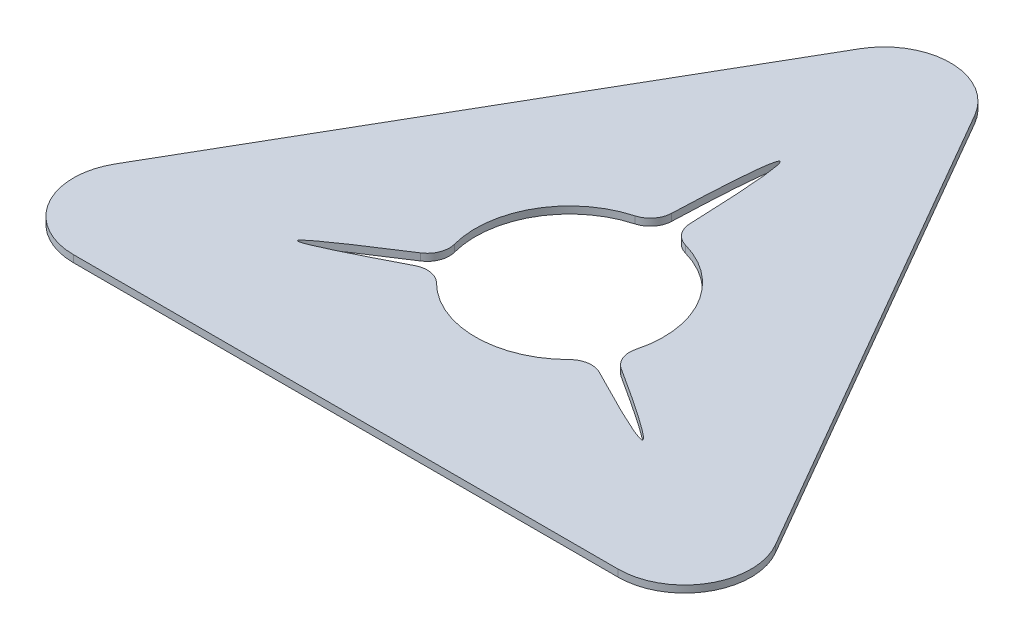
from build123d import *

# Parameters (mm, degrees)
BOSS_EXTRUDE1_DEPTH = 6.35
SKETCH2_R           = 85
CUT_EXTRUDE1_DEPTH  = 6.35
FILLET1_R           = 60
CUT_EXTRUDE2_DEPTH  = 6.35
FILLET2_R           = 20


with BuildPart() as part:
    # Sketch1 → Boss-Extrude1 (new body)
    with BuildSketch(Plane(origin=(0, 0, 0), x_dir=(1, 0, 0), z_dir=(0, 1, 0))):
        Polygon((0, 0), (-350, -606.217782649), (350, -606.217782649), align=None)
    extrude(amount=BOSS_EXTRUDE1_DEPTH)

    # Sketch2 → Cut-Extrude1 (cut)
    with BuildSketch(Plane(origin=(0, 6.35, 0), x_dir=(1, 0, 0), z_dir=(0, 1, 0))):
        with Locations((0, -404.145188433)):
            Circle(SKETCH2_R)
    extrude(amount=-CUT_EXTRUDE1_DEPTH, mode=Mode.SUBTRACT)

    # Fillet1
    fillet1_edges = [part.edges().sort_by_distance(p)[0] for p in [
        (0, 3.175, 0),
        (350, 3.175, 606.217782649),
        (-350, 3.175, 606.217782649),
    ]]
    fillet(fillet1_edges, radius=FILLET1_R)

    # Sketch3 → Cut-Extrude2 (cut)
    with BuildSketch(Plane(origin=(0, 6.35, 0), x_dir=(1, 0, 0), z_dir=(0, 1, 0))):
        with BuildLine():
            Line((30.980762114, -410.484934395), (20.980762114, -427.805442471))
            add(Edge.make_bspline(
                [(30.980762114, -410.484934395), (285.788383249, -569.145188433), (20.980762114, -427.805442471)],
                knots=[0, 0, 0, 1, 1, 1], degree=2, weights=[1, 1, 1]))
        make_face()
        with BuildLine():
            Line((-10, -374.145188433), (10, -374.145188433))
            add(Edge.make_bspline(
                [(-10, -374.145188433), (0, 225.854811567), (10, -374.145188433)],
                knots=[0, 0, 0, 1, 1, 1], degree=2, weights=[1, 0.363636364, 1]))
        make_face()
        with BuildLine():
            Line((-20.980762114, -427.805442471), (-30.980762114, -410.484934395))
            add(Edge.make_bspline(
                [(-20.980762114, -427.805442471), (-285.788383249, -569.145188433), (-30.980762114, -410.484934395)],
                knots=[0, 0, 0, 1, 1, 1], degree=2, weights=[1, 1, 1]))
        make_face()
    extrude(amount=-CUT_EXTRUDE2_DEPTH, mode=Mode.SUBTRACT)

    # Fillet2
    fillet2_edges = [part.edges().sort_by_distance(p)[0] for p in [
        (69.300578897, 3.175, 453.363373736),
        (77.274488249, 3.175, 439.552157603),
        (8.740280774, 3.175, 319.59575028),
        (-8.740280774, 3.175, 319.59575028),
        (-69.300578897, 3.175, 453.363373736),
        (-77.274488249, 3.175, 439.552157603),
    ]]
    fillet(fillet2_edges, radius=FILLET2_R)


solid = part.part
